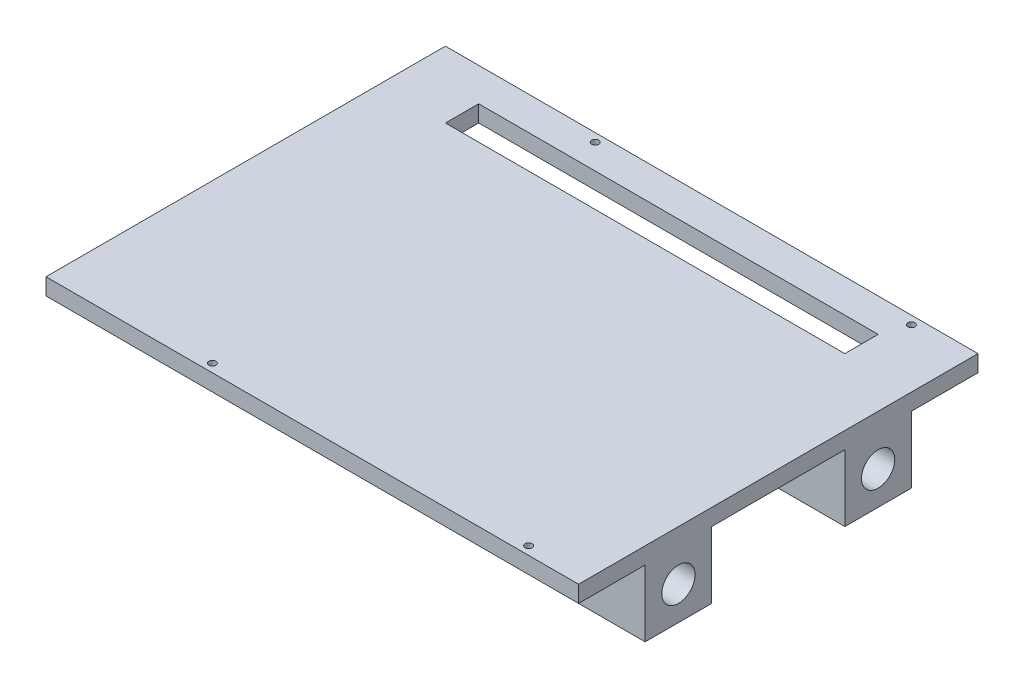
from build123d import *

# Parameters (mm, degrees)
SKETCH2_W                 = 203.2
SKETCH2_H                 = 152.4
BOSS_EXTRUDE1_DEPTH       = 6.35
SKETCH3_W                 = 152.4
SKETCH3_H                 = 12.7
CUT_EXTRUDE1_DEPTH        = 6.35
SKETCH4_W                 = 50.8
SKETCH4_H                 = 25.4
BOSS_EXTRUDE2_DEPTH       = 25.4
SKETCH7_R                 = 6.35
CUT_EXTRUDE2_DEPTH        = 50.8
CUT_EXTRUDE3_START        = -50.8
SKETCH8_R                 = 6.35
CUT_EXTRUDE3_DEPTH        = 50.8
F_6_32_TAPPED_HOLE1_D     = 2.7051
F_6_32_TAPPED_HOLE1_DEPTH = 12.7
F_6_32_TAPPED_HOLE1_TIP   = 0.81269403


with BuildPart() as part:
    # Sketch2 → Boss-Extrude1 (new body)
    with BuildSketch(Plane(origin=(0, 0, 0), x_dir=(1, 0, 0), z_dir=(0, 1, 0))):
        Rectangle(SKETCH2_W, SKETCH2_H)
    extrude(amount=BOSS_EXTRUDE1_DEPTH)

    # Sketch3 → Cut-Extrude1 (cut)
    with BuildSketch(Plane(origin=(0, 6.35, 0), x_dir=(1, 0, 0), z_dir=(0, 1, 0))):
        with Locations((0, 57.15)):
            Rectangle(SKETCH3_W, SKETCH3_H)
    extrude(amount=-CUT_EXTRUDE1_DEPTH, mode=Mode.SUBTRACT)

    # Sketch4 → Boss-Extrude2 (add)
    with BuildSketch(Plane.XZ):
        with Locations((-76.2, 38.1)):
            Rectangle(SKETCH4_W, SKETCH4_H)
        with Locations((76.2, 38.1)):
            Rectangle(SKETCH4_W, SKETCH4_H)
        with Locations((76.2, -38.1)):
            Rectangle(SKETCH4_W, SKETCH4_H)
        with Locations((-76.2, -38.1)):
            Rectangle(SKETCH4_W, SKETCH4_H)
    extrude(amount=BOSS_EXTRUDE2_DEPTH)

    # Sketch7 → Cut-Extrude2 (cut)
    with BuildSketch(Plane.ZY.offset(101.6)):
        with Locations((-38.1, -12.7)):
            Circle(SKETCH7_R)
        with Locations((38.1, -12.7)):
            Circle(SKETCH7_R)
    extrude(amount=-CUT_EXTRUDE2_DEPTH, mode=Mode.SUBTRACT)

    # Sketch8 → Cut-Extrude3 (cut)
    with BuildSketch(Plane(origin=(101.6, 0, 0), x_dir=(0, 0, -1), z_dir=(1, 0, 0)).offset(CUT_EXTRUDE3_START)):
        with Locations((-38.1, -12.7)):
            Circle(SKETCH8_R)
        with Locations((38.1, -12.7)):
            Circle(SKETCH8_R)
    extrude(amount=CUT_EXTRUDE3_DEPTH, mode=Mode.SUBTRACT)

    # #6-32 Tapped Hole1
    with Locations(Plane(origin=(0, 6.35, 0), x_dir=(1, 0, 0), z_dir=(0, 1, 0))):
        with Locations((-41.275, -73.025), (-41.275, 73.025), (79.375, 73.025), (79.375, -73.025)):
            Hole(F_6_32_TAPPED_HOLE1_D / 2, depth=F_6_32_TAPPED_HOLE1_DEPTH)
            with Locations((0, 0, -(F_6_32_TAPPED_HOLE1_DEPTH + F_6_32_TAPPED_HOLE1_TIP / 2))):  # 118° drill point
                Cone(0, F_6_32_TAPPED_HOLE1_D / 2, F_6_32_TAPPED_HOLE1_TIP, mode=Mode.SUBTRACT)


solid = part.part
